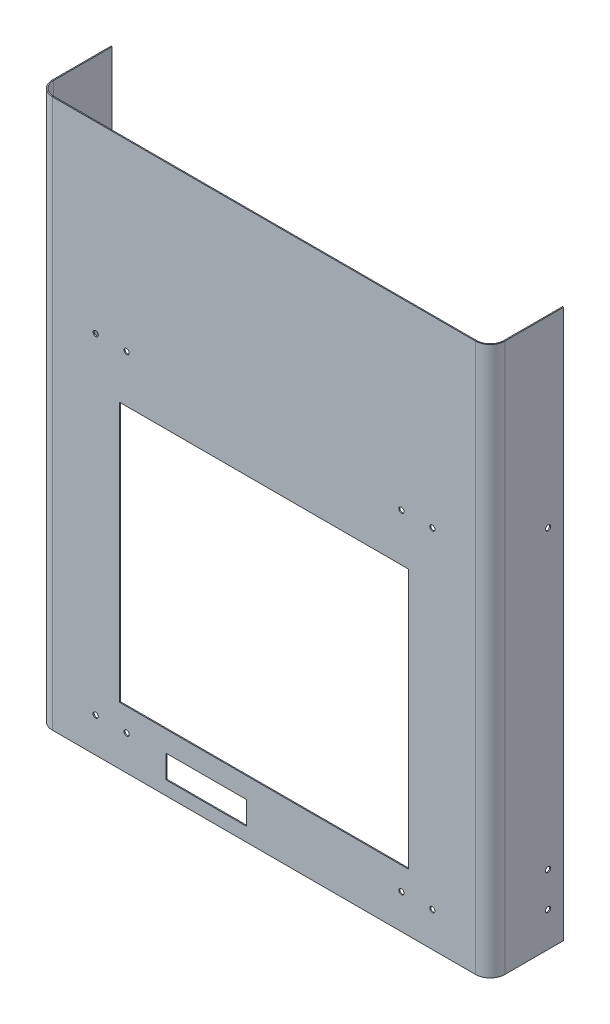
from build123d import *

# Parameters (mm, degrees)
BASE_FLANGE2_DEPTH = 475
SKETCH6_W          = 250
SKETCH6_H          = 225
CUT_EXTRUDE2_DEPTH = 2.54
SKETCH13_R         = 2.25
CUT_EXTRUDE4_DEPTH = 619.939427238
SKETCH14_R         = 2.25
CUT_EXTRUDE5_DEPTH = 0.889
SKETCH15_W         = 70
SKETCH15_H         = 20
CUT_EXTRUDE6_DEPTH = 0.889


# Sheet-metal steps are written as plain solids
with BuildPart() as part:
    # Sketch1 → Base-Flange2 (new body)
    with BuildSketch(Plane(origin=(0, 0, 0), x_dir=(1, 0, 0), z_dir=(0, 1, 0))):
        with BuildLine():
            Line((195.849919958, 63.5), (195.849919958, 12.7))
            ThreePointArc((195.849919958, 12.7), (192.130176079, 3.719743879), (183.149919958, 0))
            Line((183.149919958, 0), (-183.149919958, 0))
            ThreePointArc((-183.149919958, 0), (-192.130176079, 3.719743879), (-195.849919958, 12.7))
            Line((-195.849919958, 12.7), (-195.849919958, 63.5))
            Line((-195.849919958, 63.5), (-194.960919958, 63.5))
            Line((-194.960919958, 63.5), (-194.960919958, 12.7))
            ThreePointArc((-194.960919958, 12.7), (-191.501558151, 4.348361807), (-183.149919958, 0.889))
            Line((-183.149919958, 0.889), (183.149919958, 0.889))
            ThreePointArc((183.149919958, 0.889), (191.501558151, 4.348361807), (194.960919958, 12.7))
            Line((194.960919958, 12.7), (194.960919958, 63.5))
            Line((194.960919958, 63.5), (195.849919958, 63.5))
        make_face()
    extrude(amount=BASE_FLANGE2_DEPTH)

    # Sketch6 → Cut-Extrude2 (cut)
    with BuildSketch(Plane.XY):
        with Locations((0, 162.5)):
            Rectangle(SKETCH6_W, SKETCH6_H)
    extrude(amount=-CUT_EXTRUDE2_DEPTH, mode=Mode.SUBTRACT)

    # Sketch13 → Cut-Extrude4 (cut, through all)
    with BuildSketch(Plane(origin=(195.849919958, 0, 0), x_dir=(0, 0, -1), z_dir=(1, 0, 0))):
        with Locations((50.096107, 60)):
            Circle(SKETCH13_R)
        with Locations((50.096107, 316.132840032)):
            Circle(SKETCH13_R)
        with Locations((50.096107, 30)):
            Circle(SKETCH13_R)
    extrude(amount=-CUT_EXTRUDE4_DEPTH, mode=Mode.SUBTRACT)

    # Sketch14 → Cut-Extrude5 (cut)
    with BuildSketch(Plane.XY):
        with Locations((-145.753813013, 316.132839976)):
            Circle(SKETCH14_R)
        with Locations((-118.946026903, 316.132839976)):
            Circle(SKETCH14_R)
        with Locations((118.946026903, 316.132839976)):
            Circle(SKETCH14_R)
        with Locations((145.753813013, 316.132839976)):
            Circle(SKETCH14_R)
        with Locations((145.753813013, 30)):
            Circle(SKETCH14_R)
        with Locations((118.946026903, 30)):
            Circle(SKETCH14_R)
        with Locations((-118.946026903, 30)):
            Circle(SKETCH14_R)
        with Locations((-145.753813013, 30)):
            Circle(SKETCH14_R)
    extrude(amount=-CUT_EXTRUDE5_DEPTH, mode=Mode.SUBTRACT)

    # Sketch15 → Cut-Extrude6 (cut)
    with BuildSketch(Plane.XY):
        with Locations((-50, 22)):
            Rectangle(SKETCH15_W, SKETCH15_H)
    extrude(amount=-CUT_EXTRUDE6_DEPTH, mode=Mode.SUBTRACT)


solid = part.part
